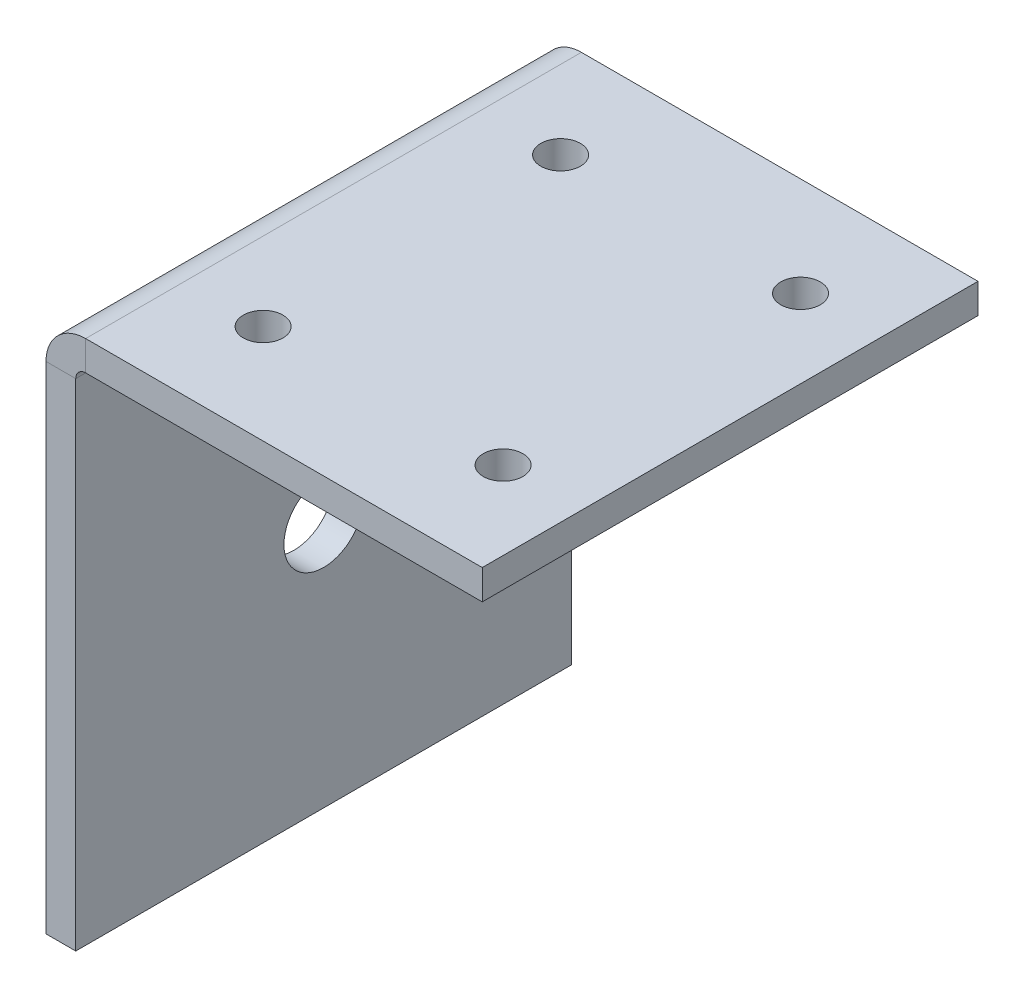
from build123d import *

# Parameters (mm, degrees)
SKETCH_1_W             = 40
SKETCH_1_H             = 50
SKETCH_1_R             = 2
SM_BASE_FLANGE_1_DEPTH = 3
SM_EDGE_FLANGE_1_DEPTH = 50
SKETCH_12_R            = 4
CUT_EXTRUDE_1_DEPTH    = 75.006756448


# Sheet-metal steps are written as plain solids
with BuildPart() as part:
    # Sketch 1 → 基体-法兰1 (new body)
    with BuildSketch(Plane(origin=(0, 0, 0), x_dir=(1, 0, 0), z_dir=(0, 1, 0))):
        Rectangle(SKETCH_1_W, SKETCH_1_H)
        with Locations(Location((12.1, 15, 0), (0, 0, 270))):
            Circle(SKETCH_1_R, mode=Mode.SUBTRACT)
        with Locations(Location((-12.1, -15, 0), (0, 0, 270))):
            Circle(SKETCH_1_R, mode=Mode.SUBTRACT)
        with Locations(Location((-12.1, 15, 0), (0, 0, 270))):
            Circle(SKETCH_1_R, mode=Mode.SUBTRACT)
        with Locations(Location((12.1, -15, 0), (0, 0, 270))):
            Circle(SKETCH_1_R, mode=Mode.SUBTRACT)
    extrude(amount=-SM_BASE_FLANGE_1_DEPTH)

    # 边线-法兰1 section (across the edge) → 边线-法兰1 (add)
    with BuildSketch(Plane(origin=(-21, -3, 25), x_dir=(1, 0, 0), z_dir=(0, 0, -1))):
        with BuildLine():
            Line((-3, 1), (-3, 51))
            Line((-3, 51), (0, 51))
            Line((0, 51), (0, 1))
            ThreePointArc((0, 1), (0.292893219, 0.292893219), (1, 0))
            Line((1, 0), (1, -3))
            ThreePointArc((1, -3), (-1.828427125, -1.828427125), (-3, 1))
        make_face()
    extrude(amount=SM_EDGE_FLANGE_1_DEPTH)

    # 草图12 → 切除-拉伸1 (cut, through all)
    with BuildSketch(Plane.ZY.offset(24)):
        with Locations(Location((0, -29, 0), (0, 0, 270))):
            Circle(SKETCH_12_R)
    extrude(amount=-CUT_EXTRUDE_1_DEPTH, mode=Mode.SUBTRACT)


solid = part.part
